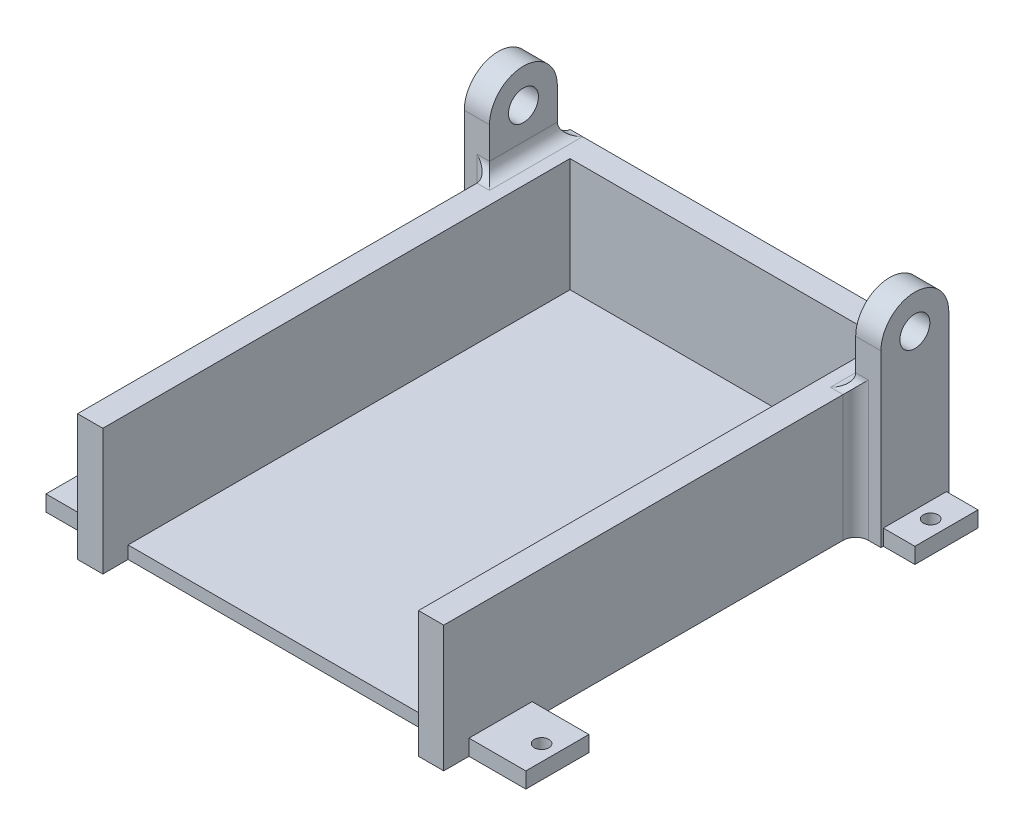
from build123d import *

# Parameters (mm, degrees)
SKETCH3_W           = 63.5
SKETCH3_H           = 88.9
BOSS_EXTRUDE1_DEPTH = 2.54
BOSS_EXTRUDE2_DEPTH = 25.4
SKETCH5_R           = 3.01625
BOSS_EXTRUDE3_DEPTH = 5.08
FILLET1_R           = 2.54
FILLET2_R           = 2.54
SKETCH6_W           = 12.7
SKETCH6_H           = 3.175
BOSS_EXTRUDE4_DEPTH = 6.35
CUT_EXTRUDE1_REACH  = 80.878
SKETCH7_R           = 1.4732
SKETCH8_W           = 12.7
SKETCH8_H           = 3.175
BOSS_EXTRUDE5_DEPTH = 11.43
CUT_EXTRUDE2_REACH  = 80.878
SKETCH9_R           = 1.4732


with BuildPart() as part:
    # Sketch3 → Boss-Extrude1 (new body)
    with BuildSketch(Plane(origin=(0, 0, 0), x_dir=(1, 0, 0), z_dir=(0, 1, 0))):
        Rectangle(SKETCH3_W, SKETCH3_H)
    extrude(amount=BOSS_EXTRUDE1_DEPTH)

    # Sketch4 → Boss-Extrude2 (add)
    with BuildSketch(Plane(origin=(0, 0, 0), x_dir=(1, 0, 0), z_dir=(0, 1, 0))):
        Polygon((-31.75, -44.45), (-31.75, 44.45), (31.75, 44.45), (31.75, -44.45), (31.75, -49.53), (36.83, -49.53), (36.83, 49.53), (-36.83, 49.53), (-36.83, -49.53), (-31.75, -49.53), align=None)
    extrude(amount=BOSS_EXTRUDE2_DEPTH)

    # Sketch5 → Boss-Extrude3 (add)
    with BuildSketch(Plane.ZY.offset(36.83)):
        with BuildLine():
            Line((-46.99, 34.29), (-46.99, 0))
            Line((-46.99, 0), (-33.3375, 0))
            Line((-33.3375, 0), (-33.3375, 34.29))
            ThreePointArc((-33.3375, 34.29), (-40.16375, 41.11625), (-46.99, 34.29))
        make_face()
        with Locations((-40.16375, 34.29)):
            Circle(SKETCH5_R, mode=Mode.SUBTRACT)
    boss_extrude3 = extrude(amount=BOSS_EXTRUDE3_DEPTH)

    # Mirror1: Boss-Extrude3 across plane
    add(boss_extrude3.mirror(Plane(origin=(0, 0, 0), x_dir=(0, 0, 1), z_dir=(1, 0, 0))))

    # Fillet1
    fillet1_edges = [part.edges().sort_by_distance(p)[0] for p in [
        (-36.83, 12.7, -46.99),
        (-36.83, 12.7, -33.3375),
        (36.83, 12.7, -46.99),
        (36.83, 12.7, -33.3375),
    ]]
    fillet(fillet1_edges, radius=FILLET1_R - 0.0001)  # a hair under: the kernel refuses the full size

    # Fillet2
    fillet2_edges = [part.edges().sort_by_distance(p)[0] for p in [
        (38.09995, 25.4, -33.3375),
        (36.83, 25.4, -40.16375),
        (38.09995, 25.4, -46.99),
        (-38.09995, 25.4, -46.99),
        (-36.83, 25.4, -40.16375),
        (-38.09995, 25.4, -33.3375),
    ]]
    fillet(fillet2_edges, radius=FILLET2_R - 0.0004)  # a hair under: the kernel refuses the full size

    # Sketch6 → Boss-Extrude4 (add)
    with BuildSketch(Plane.ZY.offset(41.91)):
        with Locations((-40.16375, 1.5875)):
            Rectangle(SKETCH6_W, SKETCH6_H)
    boss_extrude4 = extrude(amount=BOSS_EXTRUDE4_DEPTH)

    # Sketch7 → Cut-Extrude1 (cut, up to next)
    with BuildSketch(Plane(origin=(0, 3.175, 0), x_dir=(1, 0, 0), z_dir=(0, 1, 0)), mode=Mode.PRIVATE) as cut_extrude1_sk1:
        with Locations(Location((-45.085, 40.16375, 0), (0, 0, 270))):
            Circle(SKETCH7_R)
    cut_extrude1_tool1 = extrude(cut_extrude1_sk1.sketch, amount=-CUT_EXTRUDE1_REACH, mode=Mode.PRIVATE) & part.part
    cut_extrude1 = cut_extrude1_tool1.solids().sort_by_distance((-45.085, 3.175, -40.16375))[0]
    add(cut_extrude1, mode=Mode.SUBTRACT)

    # Sketch8 → Boss-Extrude5 (add)
    with BuildSketch(Plane.ZY.offset(36.83)):
        with Locations((38.1, 1.5875)):
            Rectangle(SKETCH8_W, SKETCH8_H)
    boss_extrude5 = extrude(amount=BOSS_EXTRUDE5_DEPTH)

    # Sketch9 → Cut-Extrude2 (cut, up to next)
    with BuildSketch(Plane(origin=(0, 3.175, 0), x_dir=(1, 0, 0), z_dir=(0, 1, 0)), mode=Mode.PRIVATE) as cut_extrude2_sk1:
        with Locations(Location((-45.085, -38.1, 0), (0, 0, 270))):
            Circle(SKETCH9_R)
    cut_extrude2_tool1 = extrude(cut_extrude2_sk1.sketch, amount=-CUT_EXTRUDE2_REACH, mode=Mode.PRIVATE) & part.part
    cut_extrude2 = cut_extrude2_tool1.solids().sort_by_distance((-45.085, 3.175, 38.1))[0]
    add(cut_extrude2, mode=Mode.SUBTRACT)

    # Mirror2: Boss-Extrude4, Cut-Extrude1, Boss-Extrude5, Cut-Extrude2 across plane
    add(boss_extrude4.mirror(Plane(origin=(0, 0, 0), x_dir=(0, 0, 1), z_dir=(1, 0, 0))))
    add(cut_extrude1.mirror(Plane(origin=(0, 0, 0), x_dir=(0, 0, 1), z_dir=(1, 0, 0))), mode=Mode.SUBTRACT)
    add(boss_extrude5.mirror(Plane(origin=(0, 0, 0), x_dir=(0, 0, 1), z_dir=(1, 0, 0))))
    add(cut_extrude2.mirror(Plane(origin=(0, 0, 0), x_dir=(0, 0, 1), z_dir=(1, 0, 0))), mode=Mode.SUBTRACT)


solid = part.part
